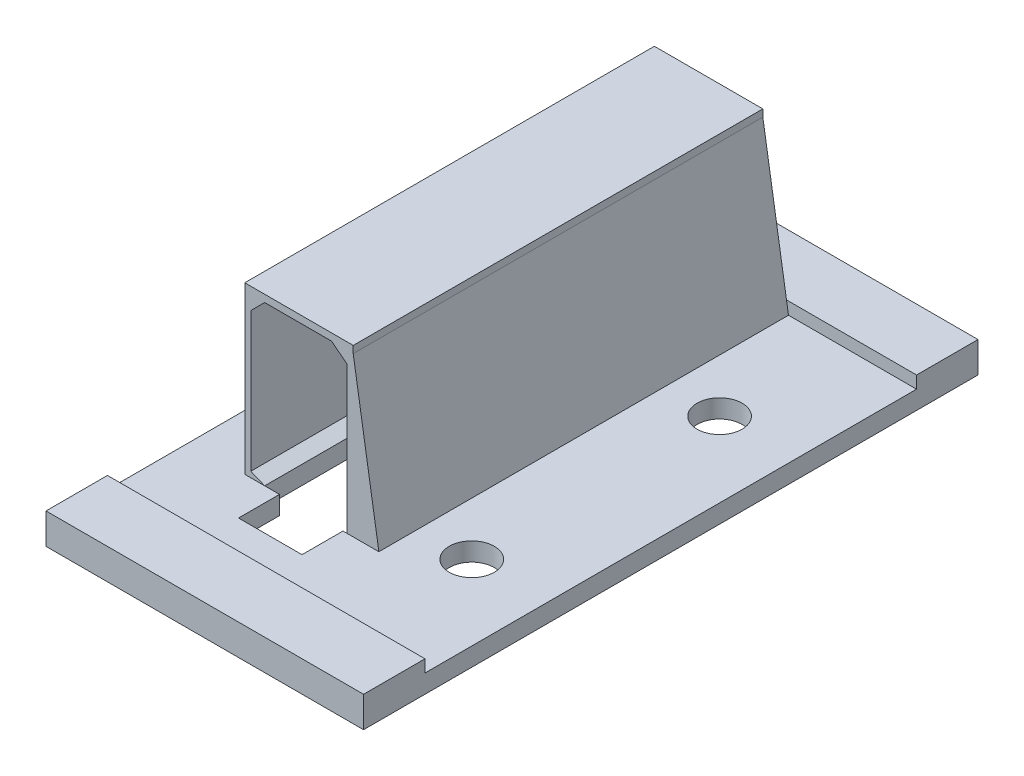
from build123d import *

# Parameters (mm, degrees)
BOSS_EXTRUDE2_DEPTH   = 3.81
BOSS_EXTRUDE2_2_DEPTH = 3.81
SKETCH2_3_W           = 39.3827
SKETCH2_3_H           = 60.96
SKETCH2_3_R           = 2.794
SKETCH2_3_W_2         = 7.874
SKETCH2_3_H_2         = 50.8
BOSS_EXTRUDE3_DEPTH   = 2.286
SKETCH2_4_W           = 0.75
SKETCH2_4_H           = 50.8
BOSS_EXTRUDE4_DEPTH   = 22.86
SKETCH4_W             = 50.8
SKETCH4_H             = 0.889
BOSS_EXTRUDE5_DEPTH   = 12.7
BOSS_EXTRUDE7_DEPTH   = 0.762
BOSS_EXTRUDE8_DEPTH   = 50.8
BOSS_EXTRUDE11_START  = 46.99
BOSS_EXTRUDE11_DEPTH  = 3.81
SKETCH8_W             = 10.208213857
SKETCH8_H             = 50.038
CUT_EXTRUDE2_DEPTH    = 89.208426668


# Read off the part's stored shape, not the designer's step: Boss-Extrude8
with BuildPart() as part:
    # Sketch2 → Boss-Extrude2 (new body)
    with BuildSketch(Plane(origin=(0, 0, 0), x_dir=(1, 0, 0), z_dir=(0, 1, 0))):
        Polygon((0, 7.62), (0, 0), (39.3827, 0), (39.3827, 7.62), (7.62, 7.62), (6.87, 7.62), align=None)
    extrude(amount=BOSS_EXTRUDE2_DEPTH)



with BuildPart() as body_2:
    # Sketch2 → Boss-Extrude2 2 (new body)
    with BuildSketch(Plane(origin=(0, 0, 0), x_dir=(1, 0, 0), z_dir=(0, 1, 0))):
        Polygon((0, 76.2), (0, 68.58), (6.87, 68.58), (7.62, 68.58), (39.3827, 68.58), (39.3827, 76.2), align=None)
    extrude(amount=BOSS_EXTRUDE2_2_DEPTH)


with BuildPart() as part_1:
    add(part.part)

    add(body_2.part)  # Boss-Extrude3 merges body 2
    # Sketch2<3> → Boss-Extrude3 (add)
    with BuildSketch(Plane(origin=(0, 0, 0), x_dir=(1, 0, 0), z_dir=(0, 1, 0))):
        with Locations((19.69135, 38.1)):
            Rectangle(SKETCH2_3_W, SKETCH2_3_H)
        with Locations(Location((30.067932262, 53.467, 0), (0, 0, 270))):
            Circle(SKETCH2_3_R, mode=Mode.SUBTRACT)
        with Locations((15.113, 38.1)):
            Rectangle(SKETCH2_3_W_2, SKETCH2_3_H_2, mode=Mode.SUBTRACT)
        with Locations(Location((30.067932262, 22.733, 0), (0, 0, 270))):
            Circle(SKETCH2_3_R, mode=Mode.SUBTRACT)
    extrude(amount=BOSS_EXTRUDE3_DEPTH)

    # Sketch2<4> → Boss-Extrude4 (add)
    with BuildSketch(Plane(origin=(0, 0, 0), x_dir=(1, 0, 0), z_dir=(0, 1, 0))):
        with Locations((7.245, 43.18)):
            Rectangle(SKETCH2_4_W, SKETCH2_4_H)
    extrude(amount=BOSS_EXTRUDE4_DEPTH)

    # Sketch4 → Boss-Extrude5 (add)
    with BuildSketch(Plane(origin=(7.62, 0, 0), x_dir=(0, 0, -1), z_dir=(1, 0, 0))):
        with Locations((43.18, 22.4155)):
            Rectangle(SKETCH4_W, SKETCH4_H)
    extrude(amount=BOSS_EXTRUDE5_DEPTH)

    # Sketch6 → Boss-Extrude7 (add)
    with BuildSketch(Plane.XY.offset(-68.58)):
        Polygon((7.62, 2.286), (23.50135, 2.286), (23.255051935, 3.81), (22.483164843, 3.81), (19.548112907, 21.971), (7.62, 21.971), align=None)
    extrude(amount=BOSS_EXTRUDE7_DEPTH)

    # Boss-Extrude8 outline → Boss-Extrude8 (add)
    with BuildSketch(Plane.XY.offset(-68.58)):
        Polygon((20.32, 21.971), (17.64673175, 21.971), (19.826070786, 20.25110095), (22.532645041, 3.503835102), (19.548112907, 2.286), (23.50135, 2.286), align=None)
        Polygon((7.62, 20.25110095), (9.33989905, 21.971), (7.62, 21.971), align=None)
        Polygon((7.62, 2.286), (9.33989905, 2.286), (7.62, 2.98989905), align=None)
    extrude(amount=BOSS_EXTRUDE8_DEPTH)

    # Sketch6<6> → Boss-Extrude11 (add)
    with BuildSketch(Plane.XY.offset(-68.58).offset(BOSS_EXTRUDE11_START)):
        Polygon((19.548112907, 20.470460804), (19.548112907, 2.286), (22.532645041, 3.503835102), (19.826070786, 20.25110095), align=None)
    extrude(amount=BOSS_EXTRUDE11_DEPTH)

    # Sketch8 → Cut-Extrude2 (cut, through all)
    with BuildSketch(Plane(origin=(0, 2.286, 0), x_dir=(1, 0, 0), z_dir=(0, 1, 0))):
        with Locations((14.444005979, 42.799)):
            Rectangle(SKETCH8_W, SKETCH8_H)
    extrude(amount=-CUT_EXTRUDE2_DEPTH, mode=Mode.SUBTRACT)


solid = part_1.part
